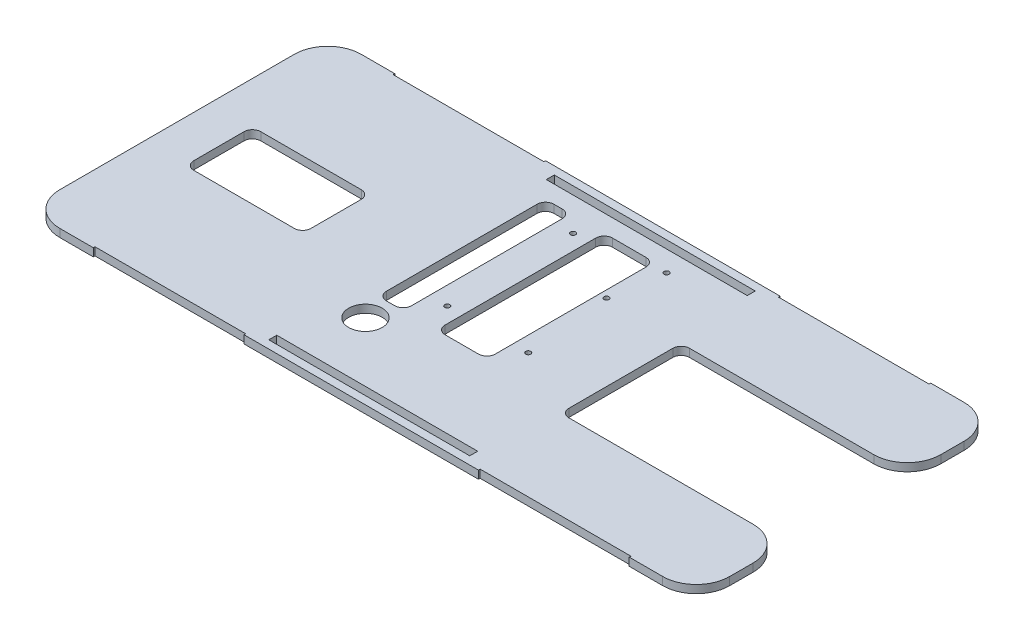
from build123d import *

# Parameters (mm, degrees)
BOSS_EXTRUDE1_DEPTH = 2.38125
SKETCH2_W           = 135
SKETCH2_H           = 72
CUT_EXTRUDE1_DEPTH  = 10
SKETCH3_R           = 10
SKETCH3_W           = 15
SKETCH3_H           = 100
SKETCH3_W_2         = 70
SKETCH3_H_2         = 40
SKETCH3_W_3         = 30
CUT_EXTRUDE2_DEPTH  = 10
SKETCH4_R           = 1.5
CUT_EXTRUDE3_DEPTH  = 10
SKETCH5_W           = 120
SKETCH5_H           = 4.7625
CUT_EXTRUDE4_DEPTH  = 10
FILLET1_R           = 20
FILLET2_R           = 20
FILLET3_R           = 5


with BuildPart() as part:
    # Sketch1 → Boss-Extrude1 (new, symmetric)
    with BuildSketch(Plane(origin=(0, 0, 0), x_dir=(1, 0, 0), z_dir=(0, 1, 0))):
        Polygon((-200, 90), (-160, 90), (-160, 89), (-70, 89), (-70, 90), (70, 90), (70, 89), (160, 89), (160, 90), (200, 90), (200, -90), (160, -90), (160, -89), (70, -89), (70, -90), (-70, -90), (-70, -89), (-160, -89), (-160, -90), (-200, -90), align=None)
    extrude(amount=BOSS_EXTRUDE1_DEPTH, both=True)

    # Sketch2 → Cut-Extrude1 (cut)
    with BuildSketch(Plane(origin=(0, 2.38125, 0), x_dir=(1, 0, 0), z_dir=(0, 1, 0))):
        with Locations((132.5, 0)):
            Rectangle(SKETCH2_W, SKETCH2_H)
    extrude(amount=-CUT_EXTRUDE1_DEPTH, mode=Mode.SUBTRACT)

    # Sketch3 → Cut-Extrude2 (cut)
    with BuildSketch(Plane(origin=(0, 2.38125, 0), x_dir=(1, 0, 0), z_dir=(0, 1, 0))):
        with Locations((-42.5, -45)):
            Circle(SKETCH3_R)
        with Locations((-42.5, 20)):
            Rectangle(SKETCH3_W, SKETCH3_H)
        with Locations((-140, 0)):
            Rectangle(SKETCH3_W_2, SKETCH3_H_2)
        with Locations((0, 20)):
            Rectangle(SKETCH3_W_3, SKETCH3_H)
    extrude(amount=-CUT_EXTRUDE2_DEPTH, mode=Mode.SUBTRACT)

    # Sketch4 → Cut-Extrude3 (cut)
    with BuildSketch(Plane(origin=(0, 2.38125, 0), x_dir=(1, 0, 0), z_dir=(0, 1, 0))):
        with Locations((24.1681, -14.4776)):
            Circle(SKETCH4_R)
        with Locations((-24.1681, -14.4776)):
            Circle(SKETCH4_R)
        with Locations((-24.1681, 60.6556)):
            Circle(SKETCH4_R)
        with Locations((24.1681, 68.1486)):
            Circle(SKETCH4_R)
        with Locations((19.289607234, 37.1479)):
            Circle(SKETCH4_R)
    extrude(amount=-CUT_EXTRUDE3_DEPTH, mode=Mode.SUBTRACT)

    # Sketch5 → Cut-Extrude4 (cut)
    with BuildSketch(Plane(origin=(0, 2.38125, 0), x_dir=(1, 0, 0), z_dir=(0, 1, 0))):
        with Locations((0, 82.85625)):
            Rectangle(SKETCH5_W, SKETCH5_H)
        with Locations((0, -82.85625)):
            Rectangle(SKETCH5_W, SKETCH5_H)
    extrude(amount=-CUT_EXTRUDE4_DEPTH, mode=Mode.SUBTRACT)

    # Fillet1
    fillet1_edges = [part.edges().sort_by_distance(p)[0] for p in [
        (-200, 0, -90),
        (-200, 0, 90),
        (200, 0, -90),
        (200, 0, 90),
    ]]
    fillet(fillet1_edges, radius=FILLET1_R)

    # Fillet2
    fillet2_edges = [part.edges().sort_by_distance(p)[0] for p in [
        (200, 0, 36),
        (200, 0, -36),
    ]]
    fillet(fillet2_edges, radius=FILLET2_R)

    # Fillet3
    fillet3_edges = [part.edges().sort_by_distance(p)[0] for p in [
        (65, 0, -36),
        (65, 0, 36),
        (15, 0, -70),
        (15, 0, 30),
        (-15, 0, 30),
        (-15, 0, -70),
        (-35, 0, -70),
        (-50, 0, -70),
        (-35, 0, 30),
        (-50, 0, 30),
        (-105, 0, 20),
        (-175, 0, 20),
        (-175, 0, -20),
        (-105, 0, -20),
    ]]
    fillet(fillet3_edges, radius=FILLET3_R)


solid = part.part
